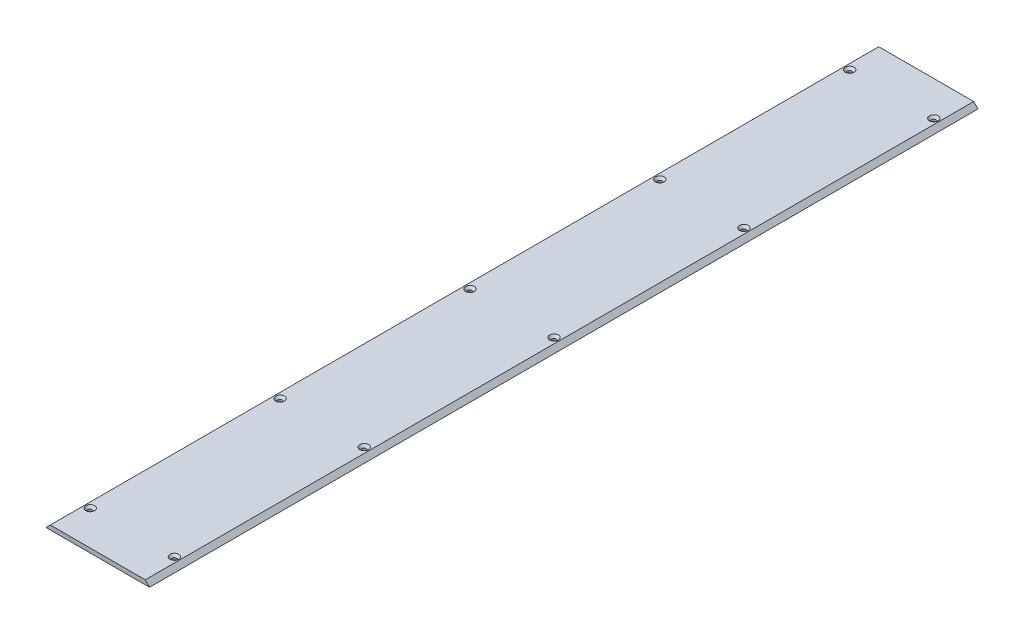
from build123d import *

# Parameters (mm, degrees)
SKETCH1_W                                     = 152.4
SKETCH1_H                                     = 1219.2
BOSS_EXTRUDE1_DEPTH                           = 6.35
CSK_FOR_1_4_FLAT_HEAD_MACHINE_SCREW1_AT_COUNT = 2
CSK_FOR_1_4_FLAT_HEAD_MACHINE_SCREW1_AT_PITCH = 123.825
CSK_FOR_1_4_FLAT_HEAD_MACHINE_SCREW1_2_COUNT  = 2
CSK_FOR_1_4_FLAT_HEAD_MACHINE_SCREW1_2_PITCH  = 305.609212271
CSK_FOR_1_4_FLAT_HEAD_MACHINE_SCREW1_3_COUNT  = 2
CSK_FOR_1_4_FLAT_HEAD_MACHINE_SCREW1_3_PITCH  = 572.354846773
CSK_FOR_1_4_FLAT_HEAD_MACHINE_SCREW1_4_COUNT  = 2
CSK_FOR_1_4_FLAT_HEAD_MACHINE_SCREW1_4_PITCH  = 847.296801968
CSK_FOR_1_4_FLAT_HEAD_MACHINE_SCREW1_5_COUNT  = 2
CSK_FOR_1_4_FLAT_HEAD_MACHINE_SCREW1_5_PITCH  = 1124.438700252
CSK_FOR_1_4_FLAT_HEAD_MACHINE_SCREW1_6_COUNT  = 2
CSK_FOR_1_4_FLAT_HEAD_MACHINE_SCREW1_6_PITCH  = 279.4
CSK_FOR_1_4_FLAT_HEAD_MACHINE_SCREW1_7_COUNT  = 2
CSK_FOR_1_4_FLAT_HEAD_MACHINE_SCREW1_7_PITCH  = 558.8
CSK_FOR_1_4_FLAT_HEAD_MACHINE_SCREW1_8_COUNT  = 2
CSK_FOR_1_4_FLAT_HEAD_MACHINE_SCREW1_8_PITCH  = 838.2
CSK_FOR_1_4_FLAT_HEAD_MACHINE_SCREW1_9_COUNT  = 2
CSK_FOR_1_4_FLAT_HEAD_MACHINE_SCREW1_9_PITCH  = 1117.6
CHAMFER1_SIZE                                 = 6.35


with BuildPart() as part:
    # Sketch1 → Boss-Extrude1 (new body)
    with BuildSketch(Plane(origin=(0, 0, 0), x_dir=(1, 0, 0), z_dir=(0, 1, 0))):
        with Locations((76.2, 609.6)):
            Rectangle(SKETCH1_W, SKETCH1_H)
    extrude(amount=BOSS_EXTRUDE1_DEPTH)

    # Sketch3 → CSK for 1/4 Flat Head Machine Screw1 (revolve, cut)
    with BuildSketch(Plane(origin=(14.2875, 6.35, -1168.4), x_dir=(0, 0, 1), z_dir=(1, 0, 0))):
        Polygon((0, 0), (0, 6.35), (3.3782, 6.35), (3.3782, 3.520932584), (6.4389, 0), align=None)
    csk_for_1_4_flat_head_machine_screw1 = revolve(axis=Axis((14.2875, 12.7, -1168.4), (0, -1, 0)), mode=Mode.SUBTRACT)

    # CSK for 1/4 Flat Head Machine Screw1 at: CSK for 1/4 Flat Head Machine Screw1 ×2
    with Locations(*[(i * CSK_FOR_1_4_FLAT_HEAD_MACHINE_SCREW1_AT_PITCH, 0, 0) for i in range(1, CSK_FOR_1_4_FLAT_HEAD_MACHINE_SCREW1_AT_COUNT)]):
        add(csk_for_1_4_flat_head_machine_screw1, mode=Mode.SUBTRACT)

    # CSK for 1_4 Flat Head Machine Screw1 2: CSK for 1/4 Flat Head Machine Screw1 ×2
    with Locations(*[Vector(0.405174304399354, 0, 0.9142394560805718) * (i * CSK_FOR_1_4_FLAT_HEAD_MACHINE_SCREW1_2_PITCH) for i in range(1, CSK_FOR_1_4_FLAT_HEAD_MACHINE_SCREW1_2_COUNT)]):
        add(csk_for_1_4_flat_head_machine_screw1, mode=Mode.SUBTRACT)

    # CSK for 1_4 Flat Head Machine Screw1 3: CSK for 1/4 Flat Head Machine Screw1 ×2
    with Locations(*[Vector(0.21634306182267615, 0, 0.9763174071997232) * (i * CSK_FOR_1_4_FLAT_HEAD_MACHINE_SCREW1_3_PITCH) for i in range(1, CSK_FOR_1_4_FLAT_HEAD_MACHINE_SCREW1_3_COUNT)]):
        add(csk_for_1_4_flat_head_machine_screw1, mode=Mode.SUBTRACT)

    # CSK for 1_4 Flat Head Machine Screw1 4: CSK for 1/4 Flat Head Machine Screw1 ×2
    with Locations(*[Vector(0.1461412337594335, 0, 0.9892637362176331) * (i * CSK_FOR_1_4_FLAT_HEAD_MACHINE_SCREW1_4_PITCH) for i in range(1, CSK_FOR_1_4_FLAT_HEAD_MACHINE_SCREW1_4_COUNT)]):
        add(csk_for_1_4_flat_head_machine_screw1, mode=Mode.SUBTRACT)

    # CSK for 1_4 Flat Head Machine Screw1 5: CSK for 1/4 Flat Head Machine Screw1 ×2
    with Locations(*[Vector(0.11012160998392527, 0, 0.9939181208804618) * (i * CSK_FOR_1_4_FLAT_HEAD_MACHINE_SCREW1_5_PITCH) for i in range(1, CSK_FOR_1_4_FLAT_HEAD_MACHINE_SCREW1_5_COUNT)]):
        add(csk_for_1_4_flat_head_machine_screw1, mode=Mode.SUBTRACT)

    # CSK for 1_4 Flat Head Machine Screw1 6: CSK for 1/4 Flat Head Machine Screw1 ×2
    with Locations(*[(0, 0, i * CSK_FOR_1_4_FLAT_HEAD_MACHINE_SCREW1_6_PITCH) for i in range(1, CSK_FOR_1_4_FLAT_HEAD_MACHINE_SCREW1_6_COUNT)]):
        add(csk_for_1_4_flat_head_machine_screw1, mode=Mode.SUBTRACT)

    # CSK for 1_4 Flat Head Machine Screw1 7: CSK for 1/4 Flat Head Machine Screw1 ×2
    with Locations(*[(0, 0, i * CSK_FOR_1_4_FLAT_HEAD_MACHINE_SCREW1_7_PITCH) for i in range(1, CSK_FOR_1_4_FLAT_HEAD_MACHINE_SCREW1_7_COUNT)]):
        add(csk_for_1_4_flat_head_machine_screw1, mode=Mode.SUBTRACT)

    # CSK for 1_4 Flat Head Machine Screw1 8: CSK for 1/4 Flat Head Machine Screw1 ×2
    with Locations(*[(0, 0, i * CSK_FOR_1_4_FLAT_HEAD_MACHINE_SCREW1_8_PITCH) for i in range(1, CSK_FOR_1_4_FLAT_HEAD_MACHINE_SCREW1_8_COUNT)]):
        add(csk_for_1_4_flat_head_machine_screw1, mode=Mode.SUBTRACT)

    # CSK for 1_4 Flat Head Machine Screw1 9: CSK for 1/4 Flat Head Machine Screw1 ×2
    with Locations(*[(0, 0, i * CSK_FOR_1_4_FLAT_HEAD_MACHINE_SCREW1_9_PITCH) for i in range(1, CSK_FOR_1_4_FLAT_HEAD_MACHINE_SCREW1_9_COUNT)]):
        add(csk_for_1_4_flat_head_machine_screw1, mode=Mode.SUBTRACT)

    # Chamfer1
    chamfer1_edges = [part.edges().sort_by_distance(p)[0] for p in [
        (0, 6.35, -609.6),
        (152.4, 6.35, -609.6),
    ]]
    chamfer(chamfer1_edges, length=CHAMFER1_SIZE - 0.0001)  # a hair under: the kernel refuses the full size


solid = part.part
